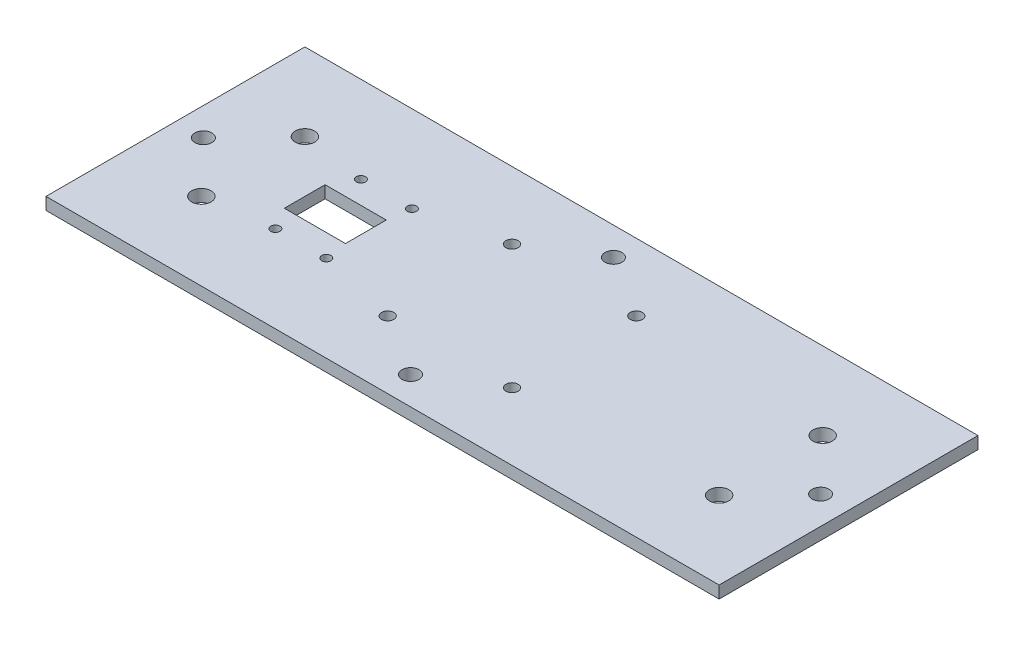
from build123d import *

# Parameters (mm, degrees)
SKETCH1_W           = 165.1
SKETCH1_H           = 63.5
BOSS_EXTRUDE1_DEPTH = 3
CUT_EXTRUDE1_REACH  = 90.496
SKETCH6_R           = 1.5
SKETCH6_W           = 15
SKETCH6_H           = 10
CUT_EXTRUDE3_REACH  = 90.496
SKETCH8_R           = 2.38125
SKETCH9_R           = 2.0828
CUT_EXTRUDE5_DEPTH  = 5.08
SKETCH10_R          = 2.0828
CUT_EXTRUDE6_DEPTH  = 5.08
SKETCH11_R          = 1.125
SKETCH11_R_2        = 1.125000036
CUT_EXTRUDE7_DEPTH  = 41.91


with BuildPart() as part:
    # Sketch1 → Boss-Extrude1 (new body)
    with BuildSketch(Plane(origin=(0, 0, 0), x_dir=(1, 0, 0), z_dir=(0, 1, 0))):
        Rectangle(SKETCH1_W, SKETCH1_H)
    extrude(amount=BOSS_EXTRUDE1_DEPTH)

    # Sketch6 → Cut-Extrude1 (cut, up to next)
    with BuildSketch(Plane.XZ, mode=Mode.PRIVATE) as cut_extrude1_sk1:
        with Locations((-15.25, 15.25)):
            Circle(SKETCH6_R)
    cut_extrude1_tool1 = extrude(cut_extrude1_sk1.sketch, amount=-CUT_EXTRUDE1_REACH, mode=Mode.PRIVATE) & part.part
    # Sketch6 → Cut-Extrude1 (cut, up to next)
    with BuildSketch(Plane.XZ, mode=Mode.PRIVATE) as cut_extrude1_sk2:
        with Locations((15.25, 15.25)):
            Circle(SKETCH6_R)
    cut_extrude1_tool2 = extrude(cut_extrude1_sk2.sketch, amount=-CUT_EXTRUDE1_REACH, mode=Mode.PRIVATE) & part.part
    # Sketch6 → Cut-Extrude1 (cut, up to next)
    with BuildSketch(Plane.XZ, mode=Mode.PRIVATE) as cut_extrude1_sk3:
        with Locations((-15.25, -15.25)):
            Circle(SKETCH6_R)
    cut_extrude1_tool3 = extrude(cut_extrude1_sk3.sketch, amount=-CUT_EXTRUDE1_REACH, mode=Mode.PRIVATE) & part.part
    # Sketch6 → Cut-Extrude1 (cut, up to next)
    with BuildSketch(Plane.XZ, mode=Mode.PRIVATE) as cut_extrude1_sk4:
        with Locations((15.25, -15.25)):
            Circle(SKETCH6_R)
    cut_extrude1_tool4 = extrude(cut_extrude1_sk4.sketch, amount=-CUT_EXTRUDE1_REACH, mode=Mode.PRIVATE) & part.part
    # Sketch6 → Cut-Extrude1 (cut, up to next)
    with BuildSketch(Plane.XZ, mode=Mode.PRIVATE) as cut_extrude1_sk5:
        with Locations((-43.3, 0.047)):
            Rectangle(SKETCH6_W, SKETCH6_H)
    cut_extrude1_tool5 = extrude(cut_extrude1_sk5.sketch, amount=-CUT_EXTRUDE1_REACH, mode=Mode.PRIVATE) & part.part
    add(cut_extrude1_tool1.solids().sort_by_distance((-15.25, 0, 15.25))[0], mode=Mode.SUBTRACT)
    add(cut_extrude1_tool2.solids().sort_by_distance((15.25, 0, 15.25))[0], mode=Mode.SUBTRACT)
    add(cut_extrude1_tool3.solids().sort_by_distance((-15.25, 0, -15.25))[0], mode=Mode.SUBTRACT)
    add(cut_extrude1_tool4.solids().sort_by_distance((15.25, 0, -15.25))[0], mode=Mode.SUBTRACT)
    add(cut_extrude1_tool5.solids().sort_by_distance((-43.3, 0, 0.047))[0], mode=Mode.SUBTRACT)

    # Sketch8 → Cut-Extrude3 (cut, up to next)
    with BuildSketch(Plane(origin=(0, 3, 0), x_dir=(1, 0, 0), z_dir=(0, 1, 0)), mode=Mode.PRIVATE) as cut_extrude3_sk1:
        with Locations((-63.5, -12.7)):
            Circle(SKETCH8_R)
    cut_extrude3_tool1 = extrude(cut_extrude3_sk1.sketch, amount=-CUT_EXTRUDE3_REACH, mode=Mode.PRIVATE) & part.part
    # Sketch8 → Cut-Extrude3 (cut, up to next)
    with BuildSketch(Plane(origin=(0, 3, 0), x_dir=(1, 0, 0), z_dir=(0, 1, 0)), mode=Mode.PRIVATE) as cut_extrude3_sk2:
        with Locations((-63.5, 12.7)):
            Circle(SKETCH8_R)
    cut_extrude3_tool2 = extrude(cut_extrude3_sk2.sketch, amount=-CUT_EXTRUDE3_REACH, mode=Mode.PRIVATE) & part.part
    # Sketch8 → Cut-Extrude3 (cut, up to next)
    with BuildSketch(Plane(origin=(0, 3, 0), x_dir=(1, 0, 0), z_dir=(0, 1, 0)), mode=Mode.PRIVATE) as cut_extrude3_sk3:
        with Locations((63.5, 12.7)):
            Circle(SKETCH8_R)
    cut_extrude3_tool3 = extrude(cut_extrude3_sk3.sketch, amount=-CUT_EXTRUDE3_REACH, mode=Mode.PRIVATE) & part.part
    # Sketch8 → Cut-Extrude3 (cut, up to next)
    with BuildSketch(Plane(origin=(0, 3, 0), x_dir=(1, 0, 0), z_dir=(0, 1, 0)), mode=Mode.PRIVATE) as cut_extrude3_sk4:
        with Locations((63.5, -12.7)):
            Circle(SKETCH8_R)
    cut_extrude3_tool4 = extrude(cut_extrude3_sk4.sketch, amount=-CUT_EXTRUDE3_REACH, mode=Mode.PRIVATE) & part.part
    add(cut_extrude3_tool1.solids().sort_by_distance((-63.5, 3, 12.7))[0], mode=Mode.SUBTRACT)
    add(cut_extrude3_tool2.solids().sort_by_distance((-63.5, 3, -12.7))[0], mode=Mode.SUBTRACT)
    add(cut_extrude3_tool3.solids().sort_by_distance((63.5, 3, -12.7))[0], mode=Mode.SUBTRACT)
    add(cut_extrude3_tool4.solids().sort_by_distance((63.5, 3, 12.7))[0], mode=Mode.SUBTRACT)

    # Sketch9 → Cut-Extrude5 (cut)
    with BuildSketch(Plane(origin=(0, 3, 0), x_dir=(1, 0, 0), z_dir=(0, 1, 0))):
        with Locations((-75.692, 0)):
            Circle(SKETCH9_R)
        with Locations((75.692, 0)):
            Circle(SKETCH9_R)
    extrude(amount=-CUT_EXTRUDE5_DEPTH, mode=Mode.SUBTRACT)

    # Sketch10 → Cut-Extrude6 (cut)
    with BuildSketch(Plane(origin=(0, 3, 0), x_dir=(1, 0, 0), z_dir=(0, 1, 0))):
        with Locations((0, -24.892)):
            Circle(SKETCH10_R)
        with Locations((0, 24.892)):
            Circle(SKETCH10_R)
    extrude(amount=-CUT_EXTRUDE6_DEPTH, mode=Mode.SUBTRACT)

    # Sketch11 → Cut-Extrude7 (cut)
    with BuildSketch(Plane(origin=(0, 3, 0), x_dir=(1, 0, 0), z_dir=(0, 1, 0))):
        with Locations((-47.55, 10.5)):
            Circle(SKETCH11_R)
        with Locations((-35.05, 10.5)):
            Circle(SKETCH11_R_2)
        with Locations((-35.05, -10.5)):
            Circle(SKETCH11_R_2)
        with Locations((-47.55, -10.5)):
            Circle(SKETCH11_R_2)
    extrude(amount=-CUT_EXTRUDE7_DEPTH, mode=Mode.SUBTRACT)


solid = part.part
